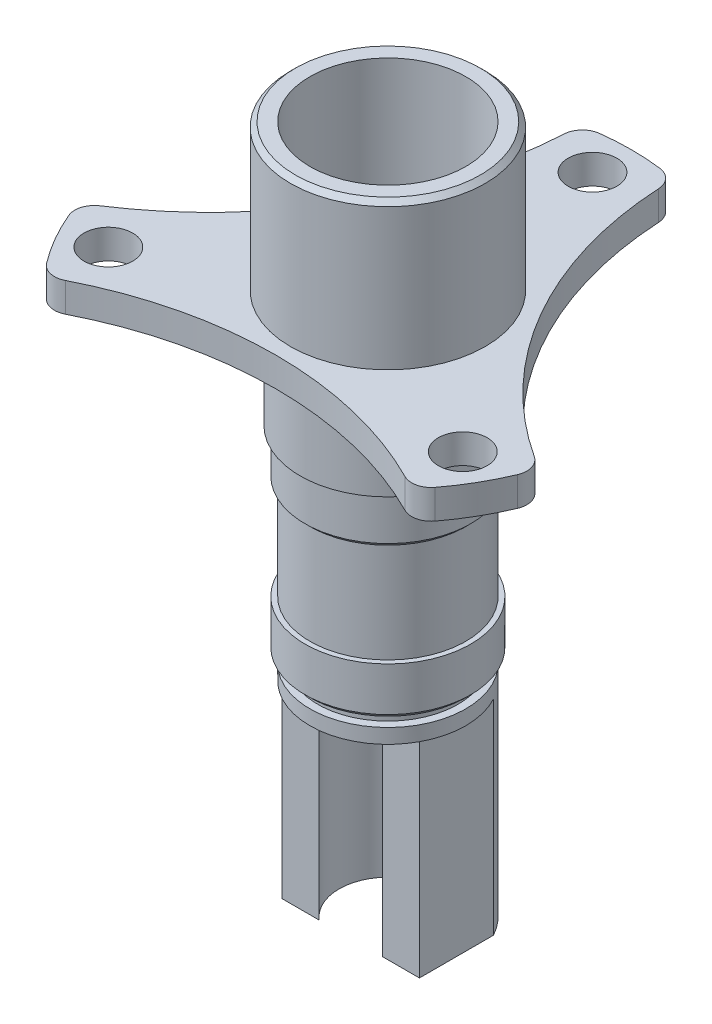
from build123d import *
from build123d.topology import SkipClean

# Parameters (mm, degrees)
EXTRUDE_START       = 21
EXTRUDE_1_DEPTH     = 21
SKETCH_5_R          = 2.5
CUT_EXTRUDE_1_DEPTH = 64.460932864
CHAMFER_1_SIZE      = 0.5
FILLET_1_R          = 2
SKETCH_9_R          = 1.5
CUT_EXTRUDE_2_DEPTH = 62.947473135
CUT_EXTRUDE_4_DEPTH = 21


with BuildPart() as part:
    # 草图2 → 旋转1 (revolve)
    with BuildSketch(Plane.XY, mode=Mode.PRIVATE) as revolve_1_sk:
        Polygon((0, 0), (0, 49.7), (10, 49.7), (10, 34.7), (25, 34.7), (25, 31.7), (9, 31.7), (9, 22.7), (8.5, 22.7), (8.5, 18.2), (8, 18.2), (8, 7.5), (8.5, 7.5), (8.5, 2.5), (8, 2.5), (7.2, 2.5), (7.2, 1.5), (8, 1.5), (8, 0), align=None)
    revolve(revolve_1_sk.sketch.rotate(Axis((0, 0, 0), (0, 1, 0)), 90), axis=Axis((0, 0, 0), (0, 1, 0)))

    # 草图3 → 凸台-拉伸1 (add)
    with BuildSketch(Plane.XZ.offset(EXTRUDE_START)):
        with BuildLine():
            Line((-7.039886363, 3.8), (-3.249615362, 3.8))
            ThreePointArc((-3.249615362, 3.8), (0, -5), (3.249615362, 3.8))
            Line((3.249615362, 3.8), (7.039886363, 3.8))
            ThreePointArc((7.039886363, 3.8), (0, -8), (-7.039886363, 3.8))
        make_face()
    extrude(amount=-EXTRUDE_1_DEPTH)

    # 草图5 → 切除-拉伸1 (cut, through all)
    with BuildSketch(Plane.XZ.offset(-31.7)):
        with BuildLine():
            ThreePointArc((-4.80408962, -24.534072693), (-9.959292144, -5.75), (-23.649175021, 8.106572693))
            ThreePointArc((-23.649175021, 8.106572693), (-21.650635095, -12.5), (-4.80408962, -24.534072693))
        make_face()
        with BuildLine():
            ThreePointArc((25, 0), (24.659981504, 4.109174155), (23.649175021, 8.106572693))
            ThreePointArc((23.649175021, 8.106572693), (9.959292144, -5.75), (4.80408962, -24.534072693))
            ThreePointArc((4.80408962, -24.534072693), (19.301583361, -15.888639959), (25, 0))
        make_face()
        with BuildLine():
            ThreePointArc((18.8450854, 16.4275), (0, 25), (-18.8450854, 16.4275))
            ThreePointArc((-18.8450854, 16.4275), (0, 11.5), (18.8450854, 16.4275))
        make_face()
        with Locations(Location((0, -21, 0), (0, 0, 270))):
            Circle(SKETCH_5_R)
        with Locations(Location((18.186533479, 10.5, 0), (0, 0, 270))):
            Circle(SKETCH_5_R)
        with Locations(Location((-18.186533479, 10.5, 0), (0, 0, 270))):
            Circle(SKETCH_5_R)
    extrude(amount=-CUT_EXTRUDE_1_DEPTH, mode=Mode.SUBTRACT)

    # 倒角1
    chamfer_1_edges = [part.edges().sort_by_distance(p)[0] for p in [
        (0, 2.5, 8.5),
        (0, 18.2, 8),
        (0, 31.7, 9),
        (0, 49.7, 10),
    ]]
    chamfer(chamfer_1_edges, length=CHAMFER_1_SIZE - 0.0001)  # a hair under: the kernel refuses the full size

    # 圆角1
    fillet_1_edges = [part.edges().sort_by_distance(p)[0] for p in [
        (-18.8450854, 33.2, 16.4275),
        (18.8450854, 33.2, 16.4275),
        (23.649175021, 33.2, 8.106572693),
        (4.80408962, 33.2, -24.534072693),
        (-4.80408962, 33.2, -24.534072693),
        (-23.649175021, 33.2, 8.106572693),
    ]]
    fillet(fillet_1_edges, radius=FILLET_1_R)

    # 草图8 → 切除-旋转1 (revolve, cut)
    with BuildSketch(Plane.XY, mode=Mode.PRIVATE) as cut_revolve_1_sk:
        Polygon((8, 34.7), (5, 34.7), (5, 0), (0, 0), (0, 49.7), (8, 49.7), align=None)
    revolve(cut_revolve_1_sk.sketch.rotate(Axis((0, 49.7, 0), (0, -1, 0)), 270), axis=Axis((0, 49.7, 0), (0, -1, 0)), mode=Mode.SUBTRACT)

    # 草图9 → 切除-拉伸2 (cut, through all)
    with SkipClean():  # the faces are left unmerged after this step: merging them gives an invalid solid
        with BuildSketch(Plane.XY.offset(3.8)):
            with Locations((0, -11.1)):
                Circle(SKETCH_9_R)
        extrude(amount=-CUT_EXTRUDE_2_DEPTH, mode=Mode.SUBTRACT)

    # 草图11 → 切除-拉伸4 (cut)
    with SkipClean():  # the faces are left unmerged after this step: merging them gives an invalid solid
        with BuildSketch(Plane.XZ.offset(21)):
            with BuildLine():
                Line((-7.039886363, 3.8), (-7.039886363, -3.8))
                ThreePointArc((-7.039886363, -3.8), (-8, 0), (-7.039886363, 3.8))
            make_face()
            with BuildLine():
                Line((7.039886363, 3.8), (7.039886363, -3.8))
                ThreePointArc((7.039886363, -3.8), (8, 0), (7.039886363, 3.8))
            make_face()
        extrude(amount=-CUT_EXTRUDE_4_DEPTH, mode=Mode.SUBTRACT)


solid = part.part
